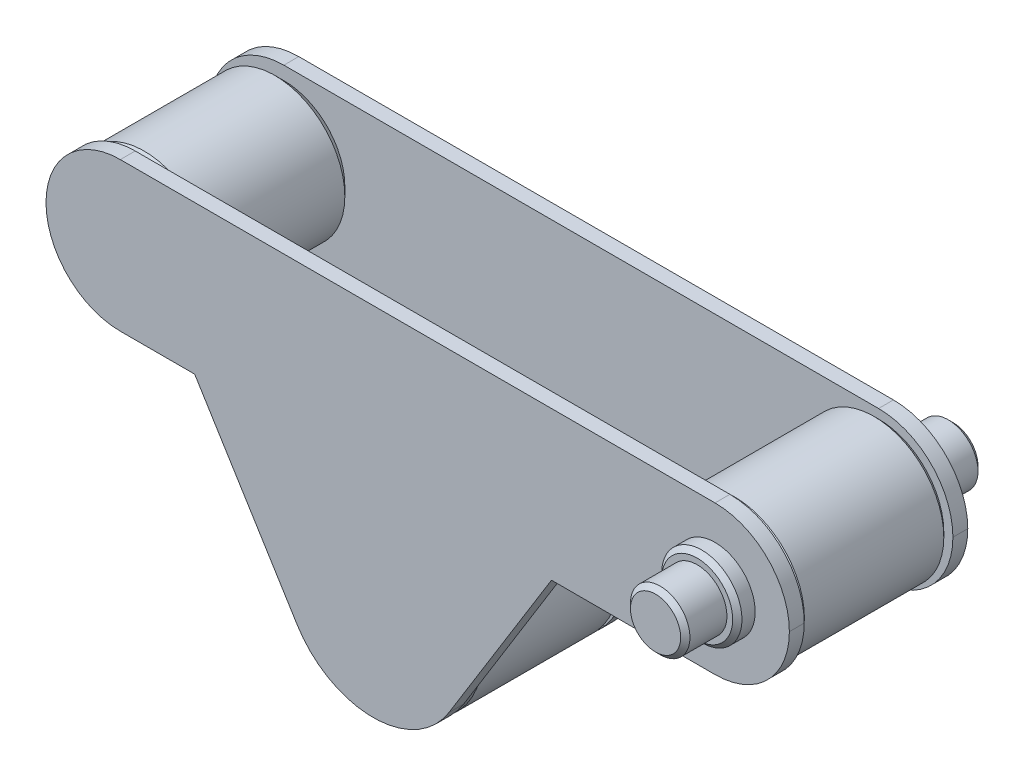
from build123d import *

# Parameters (mm, degrees)
CHAMFER_1_SIZE  = 1.56
SKETCH_2_R      = 13.5
EXTRUDE_1_DEPTH = 5
FILLET_1_R      = 25
SKETCH_3_R      = 30
EXTRUDE_2_DEPTH = 50
SKETCH_4_R      = 23.5
EXTRUDE_3_DEPTH = 50
CHAMFER_2_SIZE  = 3
CHAMFER_3_SIZE  = 2


with BuildPart() as part:
    # Эскиз1 → Повернуть1 (revolve)
    with BuildSketch(Plane(origin=(0, 0, 0), x_dir=(0, 0, -1), z_dir=(1, 0, 0)), mode=Mode.PRIVATE) as revolve_1_sk:
        Polygon((-50, 0), (-50, 10), (-36, 10), (-36, 13.5), (-25, 13.5), (-25, 23.5), (25, 23.5), (25, 13.5), (36, 13.5), (36, 10), (50, 10), (50, 0), align=None)
    revolve(revolve_1_sk.sketch.rotate(Axis((0, 0, 71.126446899), (0, 0, -1)), 90), axis=Axis((0, 0, 71.126446899), (0, 0, -1)))

    # Фаска1
    chamfer_1_edges = [part.edges().sort_by_distance(p)[0] for p in [
        (-13.5, 0, -36),
        (-23.5, 0, -25),
        (-23.5, 0, 25),
        (-13.5, 0, 36),
        (-10, 0, 50),
        (-10, 0, -50),
    ]]
    chamfer(chamfer_1_edges, length=CHAMFER_1_SIZE)


with BuildPart() as body_2:
    # Эскиз2 → Бобышка-Вытянуть1 (new body)
    with BuildSketch(Plane(origin=(0, 0, -25), x_dir=(-1, 0, 0), z_dir=(0, 0, -1))):
        with BuildLine():
            Line((-25, -25), (-25, 25))
            Line((-25, 25), (225, 25))
            Line((225, 25), (225, -25))
            Line((225, -25), (175, -25))
            Line((175, -25), (140.517165825, -80.775748738))
            ThreePointArc((140.517165825, -80.775748738), (115, -95), (89.482834175, -80.775748738))
            Line((89.482834175, -80.775748738), (55, -25))
            Line((55, -25), (-25, -25))
        make_face()
        Circle(SKETCH_2_R, mode=Mode.SUBTRACT)
    extrude(amount=EXTRUDE_1_DEPTH)

    # Скругление1
    fillet_1_edges = [body_2.edges().sort_by_distance(p)[0] for p in [
        (25, -25, -27.5),
        (25, 25, -27.5),
        (-225, -25, -27.5),
        (-225, 25, -27.5),
    ]]
    fillet(fillet_1_edges, radius=FILLET_1_R - 0.0001)  # a hair under: the kernel refuses the full size


with BuildPart() as body_3:
    # Зеркальное отражение1: mirrored copy
    add(body_2.part.mirror(Plane.XY))


with BuildPart() as body_4:
    # Эскиз3 → Бобышка-Вытянуть2 (new body)
    with BuildSketch(Plane.XY.offset(-25)):
        with Locations((-115, -65)):
            Circle(SKETCH_3_R)
    extrude(amount=EXTRUDE_2_DEPTH)

    # Фаска3
    chamfer_3_edges = [body_4.edges().sort_by_distance(p)[0] for p in [
        (-145, -65, 25),
        (-145, -65, -25),
    ]]
    chamfer(chamfer_3_edges, length=CHAMFER_3_SIZE)


with BuildPart() as body_5:
    # Эскиз4 → Бобышка-Вытянуть3 (new body)
    with BuildSketch(Plane.XY.offset(-25)):
        with Locations((-200, 0)):
            Circle(SKETCH_4_R)
    extrude(amount=EXTRUDE_3_DEPTH)

    # Фаска2
    chamfer_2_edges = [body_5.edges().sort_by_distance(p)[0] for p in [
        (-223.5, 0, -25),
        (-223.5, 0, 25),
    ]]
    chamfer(chamfer_2_edges, length=CHAMFER_2_SIZE)


solid = Compound([part.part, body_2.part, body_3.part, body_4.part, body_5.part])
